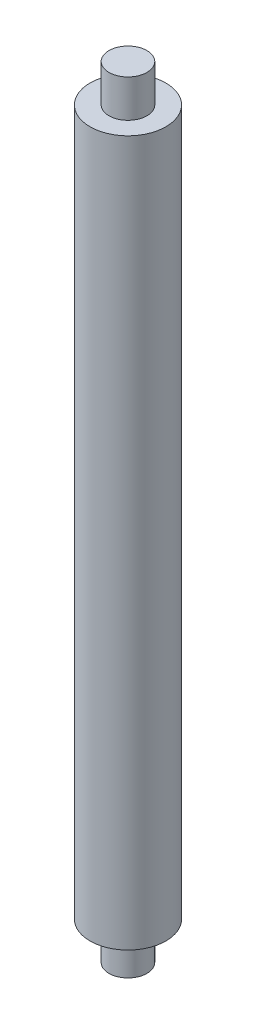
from build123d import *

# Parameters (mm, degrees)
SKETCH1_R           = 5
BOSS_EXTRUDE1_DEPTH = 92.964
SKETCH2_R           = 2.5
BOSS_EXTRUDE2_DEPTH = 4.953
BOSS_EXTRUDE3_START = 4.953
SKETCH3_R           = 2.5
BOSS_EXTRUDE3_DEPTH = 4.953


with BuildPart() as part:
    # Sketch1 → Boss-Extrude1 (new body)
    with BuildSketch(Plane(origin=(0, 0, 0), x_dir=(1, 0, 0), z_dir=(0, 1, 0))):
        Circle(SKETCH1_R)
    extrude(amount=BOSS_EXTRUDE1_DEPTH)

    # Sketch2 → Boss-Extrude2 (add)
    with BuildSketch(Plane(origin=(0, 92.964, 0), x_dir=(1, 0, 0), z_dir=(0, 1, 0))):
        Circle(SKETCH2_R)
    extrude(amount=BOSS_EXTRUDE2_DEPTH)

    # Sketch3 → Boss-Extrude3 (add)
    with BuildSketch(Plane.XZ.offset(BOSS_EXTRUDE3_START)):
        Circle(SKETCH3_R)
    extrude(amount=-BOSS_EXTRUDE3_DEPTH)


solid = part.part
